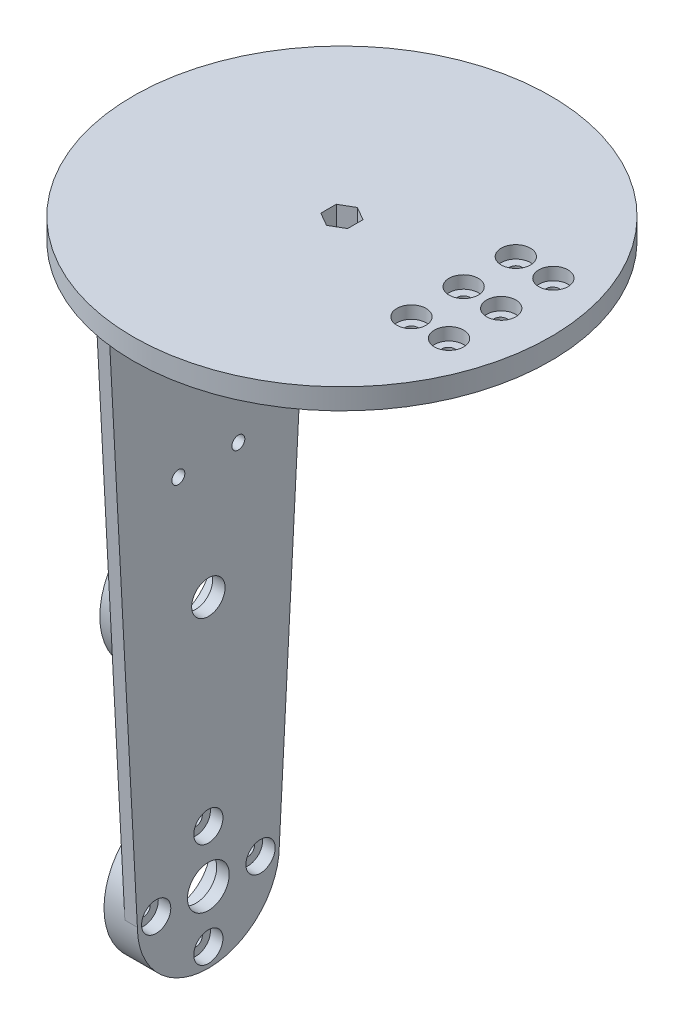
from build123d import *

# Parameters (mm, degrees)
SKETCH2_R               = 9
BOSS_EXTRUDE1_DEPTH     = 20
CUT_EXTRUDE1_DEPTH      = 20
SKETCH4_R               = 50
SKETCH4_R_2             = 4.5
BOSS_EXTRUDE3_DEPTH     = 5
CUT_EXTRUDE2_DEPTH      = 9
CUT_EXTRUDE2_DEPTH_BACK = 9
SKETCH11_R              = 1.55
CUT_EXTRUDE9_DEPTH      = 9
CUT_EXTRUDE9_DEPTH_BACK = 9
SKETCH15_R              = 1.55
SKETCH28_R              = 5
SKETCH28_R_2            = 4
SKETCH28_R_3            = 1.55
BOSS_EXTRUDE10_DEPTH    = 3
SKETCH25_R              = 17
SKETCH25_R_2            = 8.5
BOSS_EXTRUDE8_DEPTH     = 5
SKETCH26_R              = 1.55
CUT_EXTRUDE14_DEPTH     = 8
SKETCH27_R              = 3.5
CUT_EXTRUDE15_DEPTH     = 3
SKETCH16_R              = 1.55
CUT_EXTRUDE17_DEPTH     = 5
SKETCH29_R              = 3.5
CUT_EXTRUDE18_DEPTH     = 3
SKETCH30_R              = 17
SKETCH30_R_2            = 10
BOSS_EXTRUDE11_DEPTH    = 6
CUT_EXTRUDE23_START     = 9
SKETCH31_R              = 3.5
CUT_EXTRUDE23_DEPTH     = 2.5
CUT_EXTRUDE24_START     = -6.5
SKETCH31_3_R            = 3.5
CUT_EXTRUDE24_DEPTH     = 2.5
CUT_EXTRUDE25_START     = 9
SKETCH33_R              = 3.5
CUT_EXTRUDE25_DEPTH     = 2.5
CUT_EXTRUDE26_START     = -6.5
SKETCH33_2_R            = 3.5
CUT_EXTRUDE26_DEPTH     = 2.5


with BuildPart() as part:
    # Sketch2 → Boss-Extrude1 (new body)
    with BuildSketch(Plane(origin=(0, 0, 0), x_dir=(1, 0, 0), z_dir=(0, 1, 0))):
        Circle(SKETCH2_R)
    extrude(amount=BOSS_EXTRUDE1_DEPTH)

    # Sketch3 → Cut-Extrude1 (cut)
    with BuildSketch(Plane(origin=(0, 20, 0), x_dir=(1, 0, 0), z_dir=(0, 1, 0))):
        Polygon((0, 3.7), (-3.204293994, 1.85), (-3.204293994, -1.85), (0, -3.7), (3.204293994, -1.85), (3.204293994, 1.85), align=None)
    extrude(amount=-CUT_EXTRUDE1_DEPTH, mode=Mode.SUBTRACT)

    # Sketch4 → Boss-Extrude3 (add)
    with BuildSketch(Plane(origin=(0, 20, 0), x_dir=(1, 0, 0), z_dir=(0, 1, 0))):
        Circle(SKETCH4_R)
        Circle(SKETCH4_R_2, mode=Mode.SUBTRACT)
    extrude(amount=-BOSS_EXTRUDE3_DEPTH)

    # Sketch11 → Cut-Extrude2 (cut, two sides: drawn at the far end of the back side and taken through both)
    with BuildSketch(Plane(origin=(0, 0, 0), x_dir=(0.8660254037844384, 0, -0.5000000000000006), z_dir=(0.5000000000000006, 0, 0.8660254037844384)).offset(-CUT_EXTRUDE2_DEPTH_BACK)):
        with Locations((0, 5)):
            Circle(SKETCH11_R)
    extrude(amount=CUT_EXTRUDE2_DEPTH + CUT_EXTRUDE2_DEPTH_BACK, mode=Mode.SUBTRACT)

    # Sketch15 → Cut-Extrude9 (cut, two sides: drawn at the far end of the back side and taken through both)
    with BuildSketch(Plane(origin=(0, 0, 0), x_dir=(0, 0, -1), z_dir=(1, 0, 0)).offset(-CUT_EXTRUDE9_DEPTH_BACK)):
        with Locations((0, 9)):
            Circle(SKETCH15_R)
    extrude(amount=CUT_EXTRUDE9_DEPTH + CUT_EXTRUDE9_DEPTH_BACK, mode=Mode.SUBTRACT)

    # Sketch28 → Boss-Extrude10 (add)
    with BuildSketch(Plane.ZY.offset(32)):
        with BuildLine():
            Line((25, 15), (-25, 15))
            Line((-25, 15), (-17, -135))
            ThreePointArc((-17, -135), (0, -152), (17, -135))
            Line((17, -135), (25, 15))
        make_face()
        with Locations((0, -135)):
            Circle(SKETCH28_R, mode=Mode.SUBTRACT)
        with Locations((0, -75)):
            Circle(SKETCH28_R_2, mode=Mode.SUBTRACT)
        with Locations((7.186666667, -46.5)):
            Circle(SKETCH28_R_3, mode=Mode.SUBTRACT)
        with Locations((-7.186666667, -46.5)):
            Circle(SKETCH28_R_3, mode=Mode.SUBTRACT)
    extrude(amount=BOSS_EXTRUDE10_DEPTH)

    # Sketch25 → Boss-Extrude8 (add)
    with BuildSketch(Plane.ZY.offset(35)):
        with Locations((0, -135)):
            Circle(SKETCH25_R)
        with Locations((0, -135)):
            Circle(SKETCH25_R_2, mode=Mode.SUBTRACT)
    extrude(amount=BOSS_EXTRUDE8_DEPTH)

    # Sketch26 → Cut-Extrude14 (cut)
    with BuildSketch(Plane.ZY.offset(40)):
        with Locations((-12.5, -135)):
            Circle(SKETCH26_R)
        with Locations((0, -122.5)):
            Circle(SKETCH26_R)
        with Locations((12.5, -135)):
            Circle(SKETCH26_R)
        with Locations((0, -147.5)):
            Circle(SKETCH26_R)
    extrude(amount=-CUT_EXTRUDE14_DEPTH, mode=Mode.SUBTRACT)

    # Sketch27 → Cut-Extrude15 (cut)
    with BuildSketch(Plane(origin=(-32, 0, 0), x_dir=(0, 0, -1), z_dir=(1, 0, 0))):
        with Locations((-12.5, -135)):
            Circle(SKETCH27_R)
        with Locations((0, -122.5)):
            Circle(SKETCH27_R)
        with Locations((12.5, -135)):
            Circle(SKETCH27_R)
        with Locations((0, -147.5)):
            Circle(SKETCH27_R)
    extrude(amount=-CUT_EXTRUDE15_DEPTH, mode=Mode.SUBTRACT)

    # Sketch16 → Cut-Extrude17 (cut)
    with BuildSketch(Plane.XZ.offset(-15)):
        with Locations((29.154127235, 12.5)):
            Circle(SKETCH16_R)
        with Locations((29.154127235, 0)):
            Circle(SKETCH16_R)
        with Locations((29.154127235, -12.5)):
            Circle(SKETCH16_R)
        with Locations((38, -12.5)):
            Circle(SKETCH16_R)
        with Locations((38, 0)):
            Circle(SKETCH16_R)
        with Locations((38, 12.5)):
            Circle(SKETCH16_R)
    extrude(amount=-CUT_EXTRUDE17_DEPTH, mode=Mode.SUBTRACT)

    # Sketch29 → Cut-Extrude18 (cut)
    with BuildSketch(Plane(origin=(0, 20, 0), x_dir=(1, 0, 0), z_dir=(0, 1, 0))):
        with Locations((29.154127235, 12.5)):
            Circle(SKETCH29_R)
        with Locations((38.154127235, 12.5)):
            Circle(SKETCH29_R)
        with Locations((38.154127235, 0)):
            Circle(SKETCH29_R)
        with Locations((38.154127235, -12.5)):
            Circle(SKETCH29_R)
        with Locations((29.154127235, 0)):
            Circle(SKETCH29_R)
        with Locations((29.154127235, -12.5)):
            Circle(SKETCH29_R)
    extrude(amount=-CUT_EXTRUDE18_DEPTH, mode=Mode.SUBTRACT)

    # Sketch30 → Boss-Extrude11 (add)
    with BuildSketch(Plane.ZY.offset(35)):
        with Locations((0, -75)):
            Circle(SKETCH30_R)
        with Locations((0, -75)):
            Circle(SKETCH30_R_2, mode=Mode.SUBTRACT)
    extrude(amount=BOSS_EXTRUDE11_DEPTH)

    # Sketch31 → Cut-Extrude23 (cut)
    with BuildSketch(Plane(origin=(0, 0, 0), x_dir=(0.8660254037844384, 0, -0.5000000000000006), z_dir=(0.5000000000000006, 0, 0.8660254037844384)).offset(CUT_EXTRUDE23_START)):
        with Locations((0, 5)):
            Circle(SKETCH31_R)
    extrude(amount=-CUT_EXTRUDE23_DEPTH, mode=Mode.SUBTRACT)

    # Sketch31<3> → Cut-Extrude24 (cut)
    with BuildSketch(Plane(origin=(0, 0, 0), x_dir=(0.8660254037844384, 0, -0.5000000000000006), z_dir=(0.5000000000000006, 0, 0.8660254037844384)).offset(CUT_EXTRUDE24_START)):
        with Locations((0, 5)):
            Circle(SKETCH31_3_R)
    extrude(amount=-CUT_EXTRUDE24_DEPTH, mode=Mode.SUBTRACT)

    # Sketch33 → Cut-Extrude25 (cut)
    with BuildSketch(Plane(origin=(0, 0, 0), x_dir=(0, 0, -1), z_dir=(1, 0, 0)).offset(CUT_EXTRUDE25_START)):
        with Locations((0, 9)):
            Circle(SKETCH33_R)
    extrude(amount=-CUT_EXTRUDE25_DEPTH, mode=Mode.SUBTRACT)

    # Sketch33<2> → Cut-Extrude26 (cut)
    with BuildSketch(Plane(origin=(0, 0, 0), x_dir=(0, 0, -1), z_dir=(1, 0, 0)).offset(CUT_EXTRUDE26_START)):
        with Locations((0, 9)):
            Circle(SKETCH33_2_R)
    extrude(amount=-CUT_EXTRUDE26_DEPTH, mode=Mode.SUBTRACT)


solid = part.part
